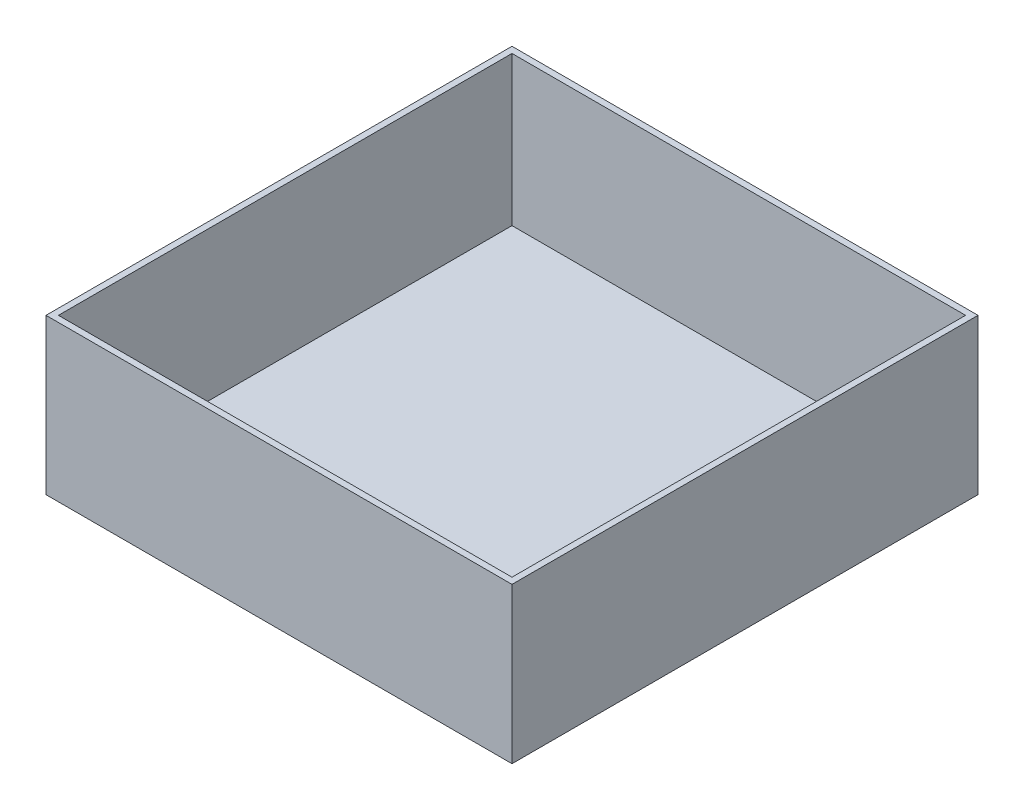
from build123d import *

# Parameters (mm, degrees)
CROQUIS1_W                   = 40
CROQUIS1_H                   = 40
SALIENTE_EXTRUIR1_DEPTH      = 0.3
SALIENTE_EXTRUIR2_DEPTH      = 10
SALIENTE_EXTRUIR2_DEPTH_BACK = 10
CROQUIS2_R                   = 2.5
CORTAR_EXTRUIR1_DEPTH        = 2.5
CORTAR_EXTRUIR1_DEPTH_BACK   = 2.5
CROQUIS3_W                   = 14.056155144
CROQUIS3_H                   = 12
CROQUIS4_W                   = 300
CROQUIS4_H                   = 100
SALIENTE_EXTRUIR3_DEPTH      = 300
VACIADO2_START               = 4.3
VACIADO2_OUTLINE_W           = 292
VACIADO2_OUTLINE_H           = 96
VACIADO2_DEPTH               = 292
VACIADO2_START_2             = 4
VACIADO2_2_OUTLINE_W         = 32
VACIADO2_2_OUTLINE_H         = 32
VACIADO2_2_DEPTH             = 0.3
VACIADO2_3_OUTLINE_W         = 2
VACIADO2_3_OUTLINE_H         = 12
VACIADO2_3_DEPTH             = 4
CROQUIS6_W                   = 32
CROQUIS6_H                   = 32
SALIENTE_EXTRUIR4_DEPTH      = 0.3


with BuildPart() as part:
    # Croquis1 → Saliente-Extruir1 (new body)
    with BuildSketch(Plane.XY):
        Rectangle(CROQUIS1_W, CROQUIS1_H)
    extrude(amount=SALIENTE_EXTRUIR1_DEPTH)

    # Croquis2 → Saliente-Extruir2 (add, two sides: drawn at the far end of the back side and taken through both)
    with BuildSketch(Plane(origin=(0, 0, 0), x_dir=(1, 0, 0), z_dir=(0, 1, 0)).offset(-SALIENTE_EXTRUIR2_DEPTH_BACK)):
        with BuildLine():
            Line((-5, 10), (-5, 0))
            Line((-5, 0), (5, 0))
            Line((5, 0), (5, 10))
            ThreePointArc((5, 10), (0, 15), (-5, 10))
        make_face()
        with Locations(Location((0, 10, 0), (0, 0, 270))):
            Circle(CROQUIS2_R, mode=Mode.SUBTRACT)
    extrude(amount=SALIENTE_EXTRUIR2_DEPTH + SALIENTE_EXTRUIR2_DEPTH_BACK)

    # Croquis3 → Cortar-Extruir1 (cut, two sides: drawn at the far end of the back side and taken through both)
    with BuildSketch(Plane(origin=(0, 0, 0), x_dir=(1, 0, 0), z_dir=(0, 1, 0)).offset(-CORTAR_EXTRUIR1_DEPTH_BACK)):
        with Locations((0, 10)):
            Rectangle(CROQUIS3_W, CROQUIS3_H)
    extrude(amount=CORTAR_EXTRUIR1_DEPTH + CORTAR_EXTRUIR1_DEPTH_BACK, mode=Mode.SUBTRACT)

    # Croquis4 → Saliente-Extruir3 (add)
    with BuildSketch(Plane.XY.offset(0.3)):
        Rectangle(CROQUIS4_W, CROQUIS4_H)
    extrude(amount=SALIENTE_EXTRUIR3_DEPTH)

    # Vaciado2: read off the stored shape, not the designer's step
    # Vaciado2 outline → Vaciado2 (cut)
    with BuildSketch(Plane.XY.offset(VACIADO2_START)):
        with Locations((0, 2)):
            Rectangle(VACIADO2_OUTLINE_W, VACIADO2_OUTLINE_H)
    extrude(amount=VACIADO2_DEPTH, mode=Mode.SUBTRACT)

    # Vaciado2 2 outline → Vaciado2 2 (cut)
    with BuildSketch(Plane.XY.offset(VACIADO2_START_2)):
        Rectangle(VACIADO2_2_OUTLINE_W, VACIADO2_2_OUTLINE_H)
    extrude(amount=VACIADO2_2_DEPTH, mode=Mode.SUBTRACT)

    # Vaciado2 3 outline → Vaciado2 3 (cut)
    with BuildSketch(Plane.XY):
        Rectangle(VACIADO2_3_OUTLINE_W, VACIADO2_3_OUTLINE_H)
    extrude(amount=VACIADO2_3_DEPTH, mode=Mode.SUBTRACT)

    # Croquis6 → Saliente-Extruir4 (add)
    with BuildSketch(Plane.XY.offset(4)):
        Rectangle(CROQUIS6_W, CROQUIS6_H)
    extrude(amount=SALIENTE_EXTRUIR4_DEPTH)


solid = part.part
